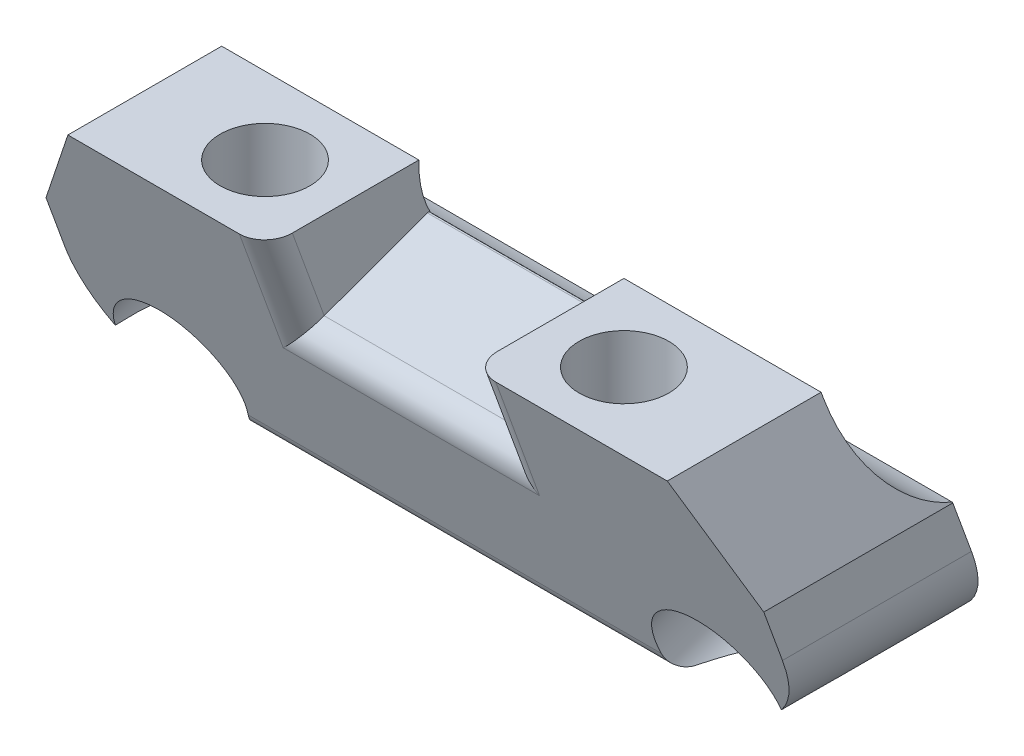
from build123d import *
from OCP.BRepFilletAPI import BRepFilletAPI_MakeChamfer

# Parameters (mm, degrees)
SKETCH1_W           = 28
SKETCH1_H           = 6
BOSS_EXTRUDE1_DEPTH = 10
BOSS_EXTRUDE2_DEPTH = 28
SKETCH3_W           = 28
SKETCH3_H           = 5.320888862
BOSS_EXTRUDE3_DEPTH = 3
CHAMFER1_SIZE       = 10
CHAMFER1_SIZE_2     = 3.639702343
FILLET1_R           = 4
CHAMFER2_SIZE       = 4
CHAMFER2_SIZE2      = 2.309401077
SKETCH4_R           = 1.75
CUT_EXTRUDE1_DEPTH  = 3
FILLET3_START       = -14
FILLET3_DEPTH       = 28
FILLET3_START_2     = -6.556503552
FILLET3_2_DEPTH     = 3.556503552
SKETCH5_R           = 1.15
CUT_EXTRUDE2_DEPTH  = 19.492502105
SKETCH6_R           = 2.5
CUT_EXTRUDE3_DEPTH  = 3
SKETCH7_W           = 8
SKETCH7_H           = 4
CUT_EXTRUDE4_DEPTH  = 19.492502219
FILLET4_R           = 1
FILLET5_R           = 1
FILLET6_R           = 1
FILLET7_R           = 0.1


with BuildPart() as part:
    # Sketch1 → Boss-Extrude1 (new body)
    with BuildSketch(Plane(origin=(0, 0, 0), x_dir=(1, 0, 0), z_dir=(0, 1, 0))):
        Rectangle(SKETCH1_W, SKETCH1_H)
    extrude(amount=BOSS_EXTRUDE1_DEPTH)

    # Sketch2 → Boss-Extrude2 (add)
    with BuildSketch(Plane.ZY.offset(14)):
        Polygon((-3, 5), (-4.819851171, 0), (-3, 0), align=None)
    extrude(amount=-BOSS_EXTRUDE2_DEPTH)

    # Sketch3 → Boss-Extrude3 (add)
    with BuildSketch(Plane(origin=(0, 1.549070307, -4.256035689), x_dir=(-1, 0, 0), z_dir=(0, 0.3420201433256627, -0.9396926207859105))):
        with Locations((0, 1.011958243)):
            Rectangle(SKETCH3_W, SKETCH3_H)
    extrude(amount=BOSS_EXTRUDE3_DEPTH)

    # Chamfer1
    # the kernel refuses this chamfer: 10, 3.639702343 mm, written as the material it takes off along each edge
    with BuildSketch(Plane(origin=(39.941947326, 0, 3), x_dir=(0, 1, 0), z_dir=(-1, 0, 0))) as chamfer1_piece_1:
        Polygon((CHAMFER1_SIZE, 0), (0, CHAMFER1_SIZE_2), (0, 0), align=None)
    extrude(amount=79.883894651, mode=Mode.SUBTRACT)

    # Fillet1
    fillet1_edges = [part.edges().sort_by_distance(p)[0] for p in [
        (14, 0, -2.729776757),
        (-14, 0, -2.729776757),
    ]]
    fillet(fillet1_edges, radius=FILLET1_R)

    # Chamfer2: one chamfer whose edges measure the first distance from different faces: ONE call of the kernel's chamfer builder (chamfer() names one face for all edges)
    chamfer2_edges_1 = [part.edges().sort_by_distance(p)[0] for p in [
        (14, 10, 0),
    ]]
    chamfer2_side_1 = [part.faces().sort_by_distance(p)[0] for p in [
        (14, 6.86562426, -1.12892367),
    ]]
    chamfer2_edges_2 = [part.edges().sort_by_distance(p)[0] for p in [
        (-14, 10, 0),
    ]]
    chamfer2_side_2 = [part.faces().sort_by_distance(p)[0] for p in [
        (-14, 6.86562426, -1.12892367),
    ]]
    chamfer2 = BRepFilletAPI_MakeChamfer(part.part.solid().wrapped)
    for e in chamfer2_edges_1:
        chamfer2.Add(CHAMFER2_SIZE, CHAMFER2_SIZE2, e.wrapped, chamfer2_side_1[0].wrapped)  # the first distance lies on this face
    for e in chamfer2_edges_2:
        chamfer2.Add(CHAMFER2_SIZE, CHAMFER2_SIZE2, e.wrapped, chamfer2_side_2[0].wrapped)  # the first distance lies on this face
    add(Compound.cast(chamfer2.Shape()), mode=Mode.REPLACE)

    # Sketch4 → Cut-Extrude1 (cut)
    with BuildSketch(Plane(origin=(0, 10, 0), x_dir=(1, 0, 0), z_dir=(0, 1, 0))):
        with Locations(Location((-7, 0, 0), (0, 0, 270))):
            Circle(SKETCH4_R)
        with Locations(Location((7, 0, 0), (0, 0, 270))):
            Circle(SKETCH4_R)
    extrude(amount=-CUT_EXTRUDE1_DEPTH, mode=Mode.SUBTRACT)

    # Fillet3: read off the stored shape, not the designer's step
    # Fillet3 outline → Fillet3 (add)
    with BuildSketch(Plane.YZ.offset(FILLET3_START)):
        with BuildLine():
            ThreePointArc((6.02606043, -5.819077862), (7.473284523, -3.781018131), (9.847764619, -3))
            Line((9.847764619, -3), (5, -3))
            Line((5, -3), (6.02606043, -5.819077862))
        make_face()
    extrude(amount=FILLET3_DEPTH)

    # Fillet3 2 outline → Fillet3 2 (cut)
    with BuildSketch(Plane.XY.offset(FILLET3_START_2)):
        Polygon((11.690598923, 10), (14, 6), (14, 11), (11.113248654, 11), align=None)
        Polygon((-11.690598923, 10), (-11.113248654, 11), (-14, 11), (-14, 6), align=None)
    extrude(amount=FILLET3_2_DEPTH, mode=Mode.SUBTRACT)

    # Sketch5 → Cut-Extrude2 (cut, through all)
    with BuildSketch(Plane(origin=(0, 0.20559637, -0.564871384), x_dir=(1, 0, 0), z_dir=(0, -0.34202014332566616, 0.9396926207859094))):
        with Locations(Location((-10.5, 1.011958243, 0), (0, 0, 270))):
            Circle(SKETCH5_R)
        with Locations(Location((10.5, 1.011958243, 0), (0, 0, 270))):
            Circle(SKETCH5_R)
    extrude(amount=-CUT_EXTRUDE2_DEPTH, mode=Mode.SUBTRACT)

    # Sketch6 → Cut-Extrude3 (cut)
    with BuildSketch(Plane(origin=(0, 0.20559637, -0.564871384), x_dir=(1, 0, 0), z_dir=(0, -0.34202014332566616, 0.9396926207859094))):
        with Locations((-10.5, 1.011958243)):
            Circle(SKETCH6_R)
        with Locations((10.5, 1.011958243)):
            Circle(SKETCH6_R)
    extrude(amount=-CUT_EXTRUDE3_DEPTH, mode=Mode.SUBTRACT)

    # Sketch7 → Cut-Extrude4 (cut, through all)
    with BuildSketch(Plane(origin=(0, 0.20559637, -0.564871384), x_dir=(1, 0, 0), z_dir=(0, -0.34202014332566627, 0.9396926207859093))):
        with Locations((0, 8.422986638)):
            Rectangle(SKETCH7_W, SKETCH7_H)
    extrude(amount=-CUT_EXTRUDE4_DEPTH, mode=Mode.SUBTRACT)

    # Fillet4
    fillet4_edges = [part.edges().sort_by_distance(p)[0] for p in [
        (-4, 8.120614758, 2.315959713),
        (0, 6.241229517, 1.631919427),
        (4, 8.120614758, 2.315959713),
    ]]
    fillet(fillet4_edges, radius=FILLET4_R)

    # Fillet5
    fillet5_edges = [part.edges().sort_by_distance(p)[0] for p in [
        (0, 0, -0.639702343),
    ]]
    fillet(fillet5_edges, radius=FILLET5_R)

    # Fillet6
    fillet6_edges = [part.edges().sort_by_distance(p)[0] for p in [
        (11.708075395, 0.383029106, -5.872214992),
        (-11.708075395, 0.383029106, -5.872214992),
        (0, 0, -4.819851171),
    ]]
    fillet(fillet6_edges, radius=FILLET6_R)

    # Fillet7
    fillet7_edges = [part.edges().sort_by_distance(p)[0] for p in [
        (0, 8.077458133, -3.413077232),
    ]]
    fillet(fillet7_edges, radius=FILLET7_R)


solid = part.part
